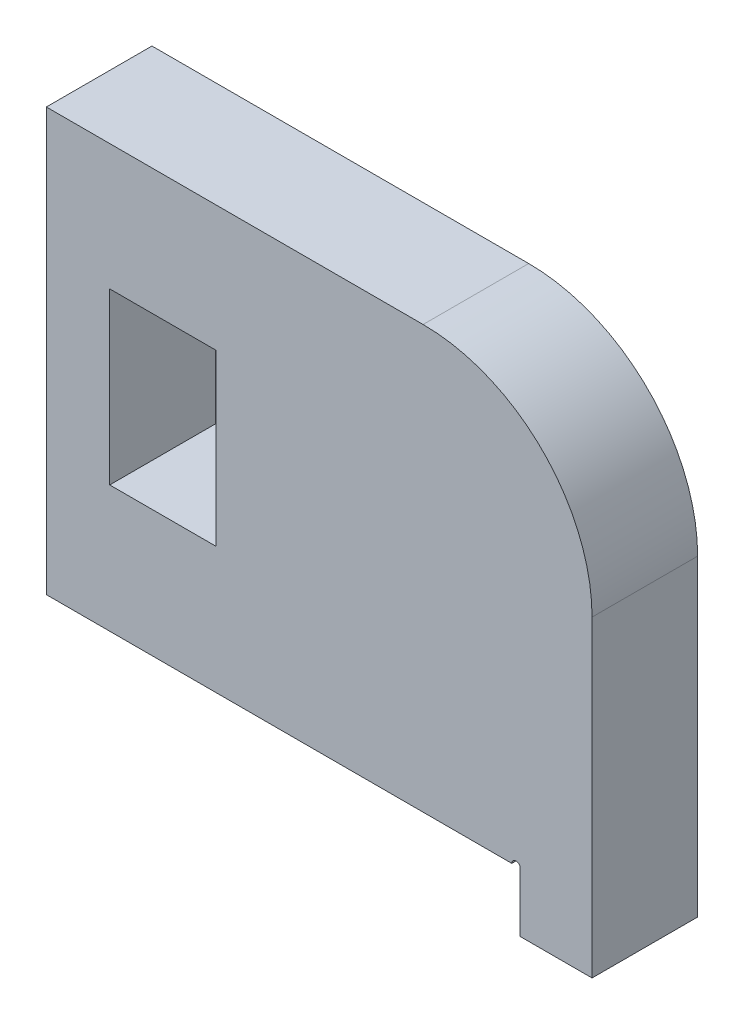
from build123d import *

# Parameters (mm, degrees)
FRAME_OUTLINE_W     = 0.252
FRAME_OUTLINE_H     = 0.402
BOSS_EXTRUDE1_DEPTH = 0.125
FILLET1_R           = 0.01
FILLET2_R           = 0.4


with BuildPart() as part:
    # frame_outline → Boss-Extrude1 (new, symmetric)
    with BuildSketch(Plane.XY):
        Polygon((0, 0), (0, 1), (1.292, 1), (1.292, -0.14), (1.122, -0.14), (1.122, 0.01), (1.102, 0.01), (1.102, 0), (0.302, 0), align=None)
        with Locations((0.276, 0.501)):
            Rectangle(FRAME_OUTLINE_W, FRAME_OUTLINE_H, mode=Mode.SUBTRACT)
    extrude(amount=BOSS_EXTRUDE1_DEPTH, both=True)

    # Fillet1
    fillet1_edges = [part.edges().sort_by_distance(p)[0] for p in [
        (1.122, 0.01, 0),
        (1.102, 0.01, 0),
    ]]
    fillet(fillet1_edges, radius=FILLET1_R - 0.0001)  # a hair under: the kernel refuses the full size

    # Fillet2
    fillet2_edges = [part.edges().sort_by_distance(p)[0] for p in [
        (1.292, 1, 0),
    ]]
    fillet(fillet2_edges, radius=FILLET2_R)


solid = part.part
